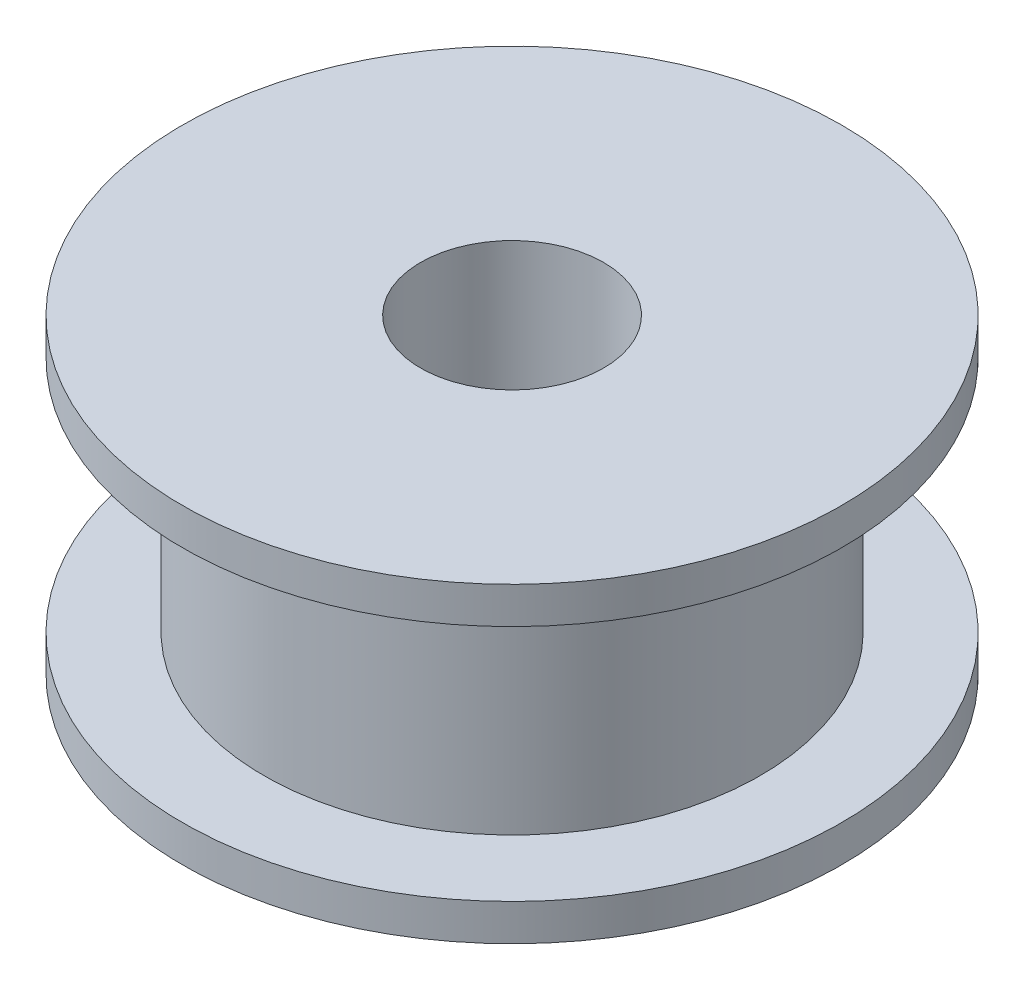
from build123d import *


with BuildPart() as part:
    # Sketch1 → Revolve1 (revolve)
    with BuildSketch(Plane.XY):
        Polygon((2.5, 4.25), (9, 4.25), (9, 3.25), (6.777827795, 3.25), (6.777827795, -3.25), (9, -3.25), (9, -4.25), (2.5, -4.25), align=None)
    revolve(axis=Axis((0, 0, 0), (0, 1, 0)))


solid = part.part
